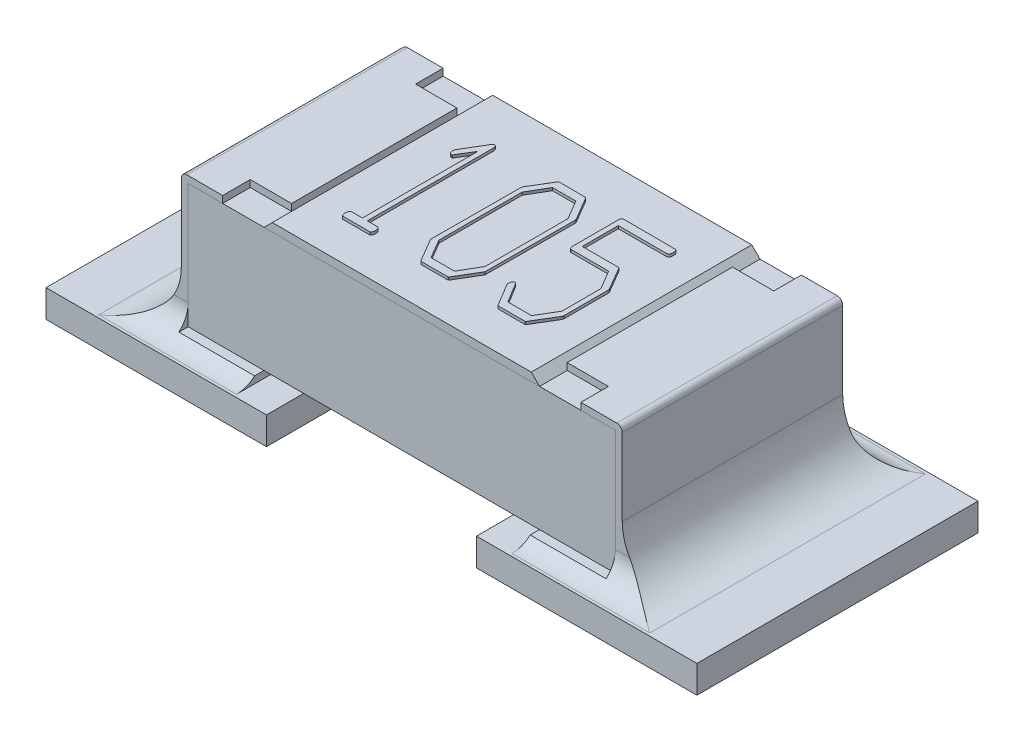
from build123d import *

# Parameters (mm, degrees)
SKETCH1_W             = 0.8
SKETCH1_H             = 0.45
BOSS_EXTRUDE1_DEPTH   = 0.775
BOSS_EXTRUDE2_DEPTH   = 0.4
BOSS_EXTRUDE2_2_DEPTH = 0.4
SKETCH3_W             = 0.15
SKETCH3_H             = 0.1
CUT_EXTRUDE1_DEPTH    = 0.025
BOSS_EXTRUDE3_DEPTH   = 0.4
BOSS_EXTRUDE4_DEPTH   = 0.01
SKETCH7_W             = 0.8
SKETCH7_H             = 1.02
BOSS_EXTRUDE5_DEPTH   = 0.1
FILLET3_R             = 0.2
FILLET4_R             = 0.2
FILLET5_R             = 0.1
FILLET6_R             = 0.1


with BuildPart() as part:
    # Sketch1 → Boss-Extrude1 (new, symmetric)
    with BuildSketch(Plane(origin=(0, 0, 0), x_dir=(0, 0, -1), z_dir=(1, 0, 0))):
        with Locations((0, 0.35)):
            Rectangle(SKETCH1_W, SKETCH1_H)
    extrude(amount=BOSS_EXTRUDE1_DEPTH, both=True)


with BuildPart() as body_2:
    # Sketch2 → Boss-Extrude2 (new, symmetric)
    with BuildSketch(Plane.XY):
        with BuildLine():
            Line((-0.5, 0.6), (-0.78, 0.6))
            ThreePointArc((-0.78, 0.6), (-0.794142136, 0.594142136), (-0.8, 0.58))
            Line((-0.8, 0.58), (-0.8, 0.1))
            Line((-0.8, 0.1), (-0.5, 0.1))
            Line((-0.5, 0.1), (-0.5, 0.125))
            Line((-0.5, 0.125), (-0.775, 0.125))
            Line((-0.775, 0.125), (-0.775, 0.575))
            Line((-0.775, 0.575), (-0.5, 0.575))
            Line((-0.5, 0.575), (-0.5, 0.6))
        make_face()
    extrude(amount=BOSS_EXTRUDE2_DEPTH, both=True)


with BuildPart() as body_3:
    # Sketch2 → Boss-Extrude2 2 (new, symmetric)
    with BuildSketch(Plane.XY):
        with BuildLine():
            Line((0.5, 0.575), (0.5, 0.6))
            Line((0.5, 0.6), (0.78, 0.6))
            ThreePointArc((0.78, 0.6), (0.794142136, 0.594142136), (0.8, 0.58))
            Line((0.8, 0.58), (0.8, 0.1))
            Line((0.8, 0.1), (0.5, 0.1))
            Line((0.5, 0.1), (0.5, 0.125))
            Line((0.5, 0.125), (0.775, 0.125))
            Line((0.775, 0.125), (0.775, 0.575))
            Line((0.775, 0.575), (0.5, 0.575))
        make_face()
    extrude(amount=BOSS_EXTRUDE2_2_DEPTH, both=True)


with BuildPart() as cut_extrude1_tool:
    # Sketch3 → Cut-Extrude1 (new body)
    with BuildSketch(Plane(origin=(0, 0.6, 0), x_dir=(1, 0, 0), z_dir=(0, 1, 0))):
        with Locations((-0.575, 0.35)):
            Rectangle(SKETCH3_W, SKETCH3_H)
        with Locations((-0.575, -0.35)):
            Rectangle(SKETCH3_W, SKETCH3_H)
        with Locations((0.575, -0.35)):
            Rectangle(SKETCH3_W, SKETCH3_H)
        with Locations((0.575, 0.35)):
            Rectangle(SKETCH3_W, SKETCH3_H)
    extrude(amount=-CUT_EXTRUDE1_DEPTH)


with BuildPart() as body_2_1:
    add(body_2.part)

    # Cut-Extrude1: cut by cut_extrude1_tool
    add(cut_extrude1_tool.part, mode=Mode.SUBTRACT)



with BuildPart() as body_3_1:
    add(body_3.part)

    # Cut-Extrude1: cut by cut_extrude1_tool
    add(cut_extrude1_tool.part, mode=Mode.SUBTRACT)


with BuildPart() as body_4:
    # Sketch4 → Boss-Extrude3 (new, symmetric)
    with BuildSketch(Plane.XY):
        Polygon((-0.5, 0.575), (0.5, 0.575), (0.47, 0.605), (-0.47, 0.605), align=None)
    extrude(amount=BOSS_EXTRUDE3_DEPTH, both=True)

    # Sketch6 → Boss-Extrude4 (add)
    # profile 1 of 3: a face of its own
    with BuildSketch(Plane(origin=(0, 0.605, 0), x_dir=(1, 0, 0), z_dir=(0, 1, 0))):
        with BuildLine():
            Line((-0.292857143, 0.221819196), (-0.292857143, -0.232142857))
            Line((-0.292857143, -0.232142857), (-0.253608631, -0.232142857))
            add(Edge.make_bspline(
                [(-0.253608631, -0.232142857), (-0.252514915, -0.233159523), (-0.250346122, -0.235175528), (-0.248921239, -0.239323698), (-0.247952001, -0.243100354), (-0.24781151, -0.245561302), (-0.247749256, -0.246651786)],
                knots=[0, 0, 0, 0, 1.094507773, 2.170363376, 3.18925981, 4, 4, 4, 4], degree=3))
            add(Edge.make_bspline(
                [(-0.247749256, -0.246651786), (-0.247790011, -0.24890061), (-0.247860511, -0.252790757), (-0.248927629, -0.257670974), (-0.250957131, -0.261266063), (-0.253164339, -0.261705298), (-0.254166667, -0.261904762)],
                knots=[0, 0, 0, 0, 1.483935822, 2.566997854, 3.349251094, 4, 4, 4, 4], degree=3))
            Line((-0.254166667, -0.261904762), (-0.352287946, -0.261904762))
            add(Edge.make_bspline(
                [(-0.352287946, -0.261904762), (-0.353191845, -0.261383497), (-0.355138277, -0.260261018), (-0.356845026, -0.256793507), (-0.357784968, -0.252323852), (-0.357898096, -0.248923727), (-0.35796131, -0.24702381)],
                knots=[0, 0, 0, 0, 0.731657516, 1.575533429, 2.645259425, 4, 4, 4, 4], degree=3))
            add(Edge.make_bspline(
                [(-0.35796131, -0.24702381), (-0.357847061, -0.245999991), (-0.357543408, -0.24327885), (-0.356855684, -0.239634421), (-0.355750939, -0.236384481), (-0.354715358, -0.234196716), (-0.35312544, -0.232808963), (-0.351931893, -0.232359173), (-0.351357887, -0.232142857)],
                knots=[0, 0, 0, 0, 1.077846596, 2.864738214, 3.859388994, 4.671949365, 5.361307703, 6, 6, 6, 6], degree=3))
            Line((-0.351357887, -0.232142857), (-0.310714286, -0.232142857))
            Line((-0.310714286, -0.232142857), (-0.310714286, 0.186476935))
            Line((-0.310714286, 0.186476935), (-0.345219494, 0.130208333))
            add(Edge.make_bspline(
                [(-0.345219494, 0.130208333), (-0.34594703, 0.129816395), (-0.34723663, 0.129121662), (-0.348681862, 0.128906863), (-0.349311756, 0.128813244)],
                knots=[0, 0, 0, 0, 1.128313794, 2, 2, 2, 2], degree=3))
            add(Edge.make_bspline(
                [(-0.349311756, 0.128813244), (-0.34994165, 0.128906863), (-0.351386882, 0.129121662), (-0.352676481, 0.129816395), (-0.353404018, 0.130208333)],
                knots=[0, 0, 0, 0, 0.871686206, 2, 2, 2, 2], degree=3))
            add(Edge.make_bspline(
                [(-0.353404018, 0.130208333), (-0.354762035, 0.132029405), (-0.357658077, 0.135912935), (-0.35809911, 0.140752164), (-0.358333333, 0.143322173)],
                knots=[0, 0, 0, 0, 0.937843913, 2, 2, 2, 2], degree=3))
            Line((-0.358333333, 0.143322173), (-0.357124256, 0.150297619))
            Line((-0.357124256, 0.150297619), (-0.306901042, 0.234654018))
            add(Edge.make_bspline(
                [(-0.306901042, 0.234654018), (-0.306052725, 0.23565958), (-0.304616067, 0.23736254), (-0.302476074, 0.237882361), (-0.301599702, 0.238095238)],
                knots=[0, 0, 0, 0, 1.180958283, 2, 2, 2, 2], degree=3))
            add(Edge.make_bspline(
                [(-0.301599702, 0.238095238), (-0.300254548, 0.237901979), (-0.297496165, 0.23750568), (-0.29448599, 0.233775342), (-0.293094631, 0.228376002), (-0.292944039, 0.224218313), (-0.292857143, 0.221819196)],
                knots=[0, 0, 0, 0, 0.76869288, 1.576286457, 2.601441333, 4, 4, 4, 4], degree=3))
        make_face()
    # profile 2 of 3: a face of its own
    with BuildSketch(Plane(origin=(0, 0.605, 0), x_dir=(1, 0, 0), z_dir=(0, 1, 0))):
        Polygon((0.032849702, 0.234002976), (0.081305804, 0.151227679), (0.082142857, 0.145182292), (0.080561756, -0.178478423), (0.031268601, -0.26125372), (0.027269345, -0.261904762), (-0.068526786, -0.261904762), (-0.07094494, -0.259207589), (-0.119866071, -0.17578125), (-0.120238095, -0.168991815), (-0.118656994, 0.154668899), (-0.069363839, 0.236700149), (-0.066945685, 0.238095238), (0.030059524, 0.237444196), align=None)
        Polygon((0.064285714, 0.138764881), (0.023549107, 0.208333333), (-0.061644345, 0.208333333), (-0.102380952, 0.138764881), (-0.102380952, -0.162574405), (-0.061644345, -0.232142857), (0.023549107, -0.232142857), (0.064285714, -0.161923363), align=None, mode=Mode.SUBTRACT)
    # profile 3 of 3: a face of its own
    with BuildSketch(Plane(origin=(0, 0.605, 0), x_dir=(1, 0, 0), z_dir=(0, 1, 0))):
        with BuildLine():
            add(Edge.make_bspline(
                [(0.356696429, 0.23735119), (0.357390117, 0.236998182), (0.358932932, 0.236213063), (0.360466468, 0.233639053), (0.361417328, 0.230159801), (0.361729175, 0.227501332), (0.361904762, 0.226004464)],
                knots=[0, 0, 0, 0, 0.70025326, 1.557416071, 2.624688148, 4, 4, 4, 4], degree=3))
            add(Edge.make_bspline(
                [(0.361904762, 0.226004464), (0.361861176, 0.223332993), (0.361786524, 0.218757421), (0.360556675, 0.213479134), (0.35865234, 0.210489827), (0.356407312, 0.209169375), (0.35354494, 0.208486435), (0.35143045, 0.208387311), (0.350279018, 0.208333333)],
                knots=[0, 0, 0, 0, 1.941627251, 3.325529191, 3.875776305, 4.463521516, 5.163320262, 6, 6, 6, 6], degree=3))
            Line((0.350279018, 0.208333333), (0.177380952, 0.208333333))
            Line((0.177380952, 0.208333333), (0.177380952, 0.077380952))
            Line((0.177380952, 0.077380952), (0.310100446, 0.077380952))
            Line((0.310100446, 0.077380952), (0.312890625, 0.07468378))
            Line((0.312890625, 0.07468378), (0.361067708, -0.008091518))
            Line((0.361067708, -0.008091518), (0.361904762, -0.014136905))
            Line((0.361904762, -0.014136905), (0.361904762, -0.173735119))
            Line((0.361904762, -0.173735119), (0.360323661, -0.179129464))
            Line((0.360323661, -0.179129464), (0.311030506, -0.26125372))
            Line((0.311030506, -0.26125372), (0.30703125, -0.261904762))
            Line((0.30703125, -0.261904762), (0.211235119, -0.261904762))
            Line((0.211235119, -0.261904762), (0.208816964, -0.259207589))
            Line((0.208816964, -0.259207589), (0.159895833, -0.177548363))
            add(Edge.make_bspline(
                [(0.159895833, -0.177548363), (0.159788443, -0.176681244), (0.159517027, -0.174489697), (0.159521255, -0.17228021), (0.15952381, -0.17094494)],
                knots=[0, 0, 0, 0, 0.791330927, 2, 2, 2, 2], degree=3))
            add(Edge.make_bspline(
                [(0.15952381, -0.17094494), (0.159518098, -0.169980402), (0.159508843, -0.168417682), (0.159788707, -0.166882343), (0.159895833, -0.166294643)],
                knots=[0, 0, 0, 0, 1.234435563, 2, 2, 2, 2], degree=3))
            add(Edge.make_bspline(
                [(0.159895833, -0.166294643), (0.160226067, -0.165050815), (0.160834803, -0.162758001), (0.162727701, -0.160041395), (0.164776814, -0.157801232), (0.166610492, -0.157262127), (0.167522321, -0.156994048)],
                knots=[0, 0, 0, 0, 1.206652828, 2.224285909, 3.116994777, 4, 4, 4, 4], degree=3))
            add(Edge.make_bspline(
                [(0.167522321, -0.156994048), (0.168857155, -0.15729556), (0.171874372, -0.157977088), (0.173439211, -0.160689792), (0.174311756, -0.162202381)],
                knots=[0, 0, 0, 0, 0.884811277, 2, 2, 2, 2], degree=3))
            Line((0.174311756, -0.162202381), (0.217280506, -0.232142857))
            Line((0.217280506, -0.232142857), (0.303031994, -0.232142857))
            Line((0.303031994, -0.232142857), (0.344047619, -0.163039435))
            Line((0.344047619, -0.163039435), (0.344047619, -0.021484375))
            Line((0.344047619, -0.021484375), (0.303031994, 0.047619048))
            Line((0.303031994, 0.047619048), (0.166313244, 0.047619048))
            add(Edge.make_bspline(
                [(0.166313244, 0.047619048), (0.165662133, 0.047815844), (0.164284314, 0.048232285), (0.162709607, 0.050043248), (0.161293355, 0.052385043), (0.160690332, 0.054295008), (0.160360863, 0.055338542)],
                knots=[0, 0, 0, 0, 0.784358085, 1.659783815, 2.721393447, 4, 4, 4, 4], degree=3))
            Line((0.160360863, 0.055338542), (0.15952381, 0.060174851))
            Line((0.15952381, 0.060174851), (0.15952381, 0.228329613))
            add(Edge.make_bspline(
                [(0.15952381, 0.228329613), (0.159742696, 0.229435854), (0.160162193, 0.231555964), (0.161730856, 0.234291253), (0.163736116, 0.23656856), (0.165442528, 0.23757943), (0.166313244, 0.238095238)],
                knots=[0, 0, 0, 0, 1.088067023, 2.085278741, 3.022991718, 4, 4, 4, 4], degree=3))
            Line((0.166313244, 0.238095238), (0.356696429, 0.23735119))
        make_face()
    extrude(amount=BOSS_EXTRUDE4_DEPTH)


with BuildPart() as body_2_2:
    add(body_2_1.part)

    add(body_3_1.part)  # Boss-Extrude5 merges body 3
    # Sketch7 → Boss-Extrude5 (add)
    with BuildSketch(Plane(origin=(0, 0, 0), x_dir=(1, 0, 0), z_dir=(0, 1, 0))):
        with Locations((-0.781, 0)):
            Rectangle(SKETCH7_W, SKETCH7_H)
        with Locations((0.781, 0)):
            Rectangle(SKETCH7_W, SKETCH7_H)
    extrude(amount=BOSS_EXTRUDE5_DEPTH)

    # Fillet3
    fillet3_edges = [body_2_2.edges().sort_by_distance(p)[0] for p in [
        (-0.8, 0.1, 0),
    ]]
    fillet(fillet3_edges, radius=FILLET3_R)

    # Fillet4
    fillet4_edges = [body_2_2.edges().sort_by_distance(p)[0] for p in [
        (0.8, 0.1, 0),
    ]]
    fillet(fillet4_edges, radius=FILLET4_R)

    # Fillet5
    fillet5_edges = [body_2_2.edges().sort_by_distance(p)[0] for p in [
        (0.75, 0.1, 0.4),
    ]]
    fillet(fillet5_edges, radius=FILLET5_R)
    fillet5_2_edges = [body_2_2.edges().sort_by_distance(p)[0] for p in [
        (0.75, 0.1, -0.4),
    ]]
    fillet(fillet5_2_edges, radius=FILLET5_R)

    # Fillet6
    fillet6_edges = [body_2_2.edges().sort_by_distance(p)[0] for p in [
        (-0.75, 0.1, -0.4),
    ]]
    fillet(fillet6_edges, radius=FILLET6_R)
    fillet6_2_edges = [body_2_2.edges().sort_by_distance(p)[0] for p in [
        (-0.75, 0.1, 0.4),
    ]]
    fillet(fillet6_2_edges, radius=FILLET6_R)


solid = Compound([part.part, body_4.part, body_2_2.part])
